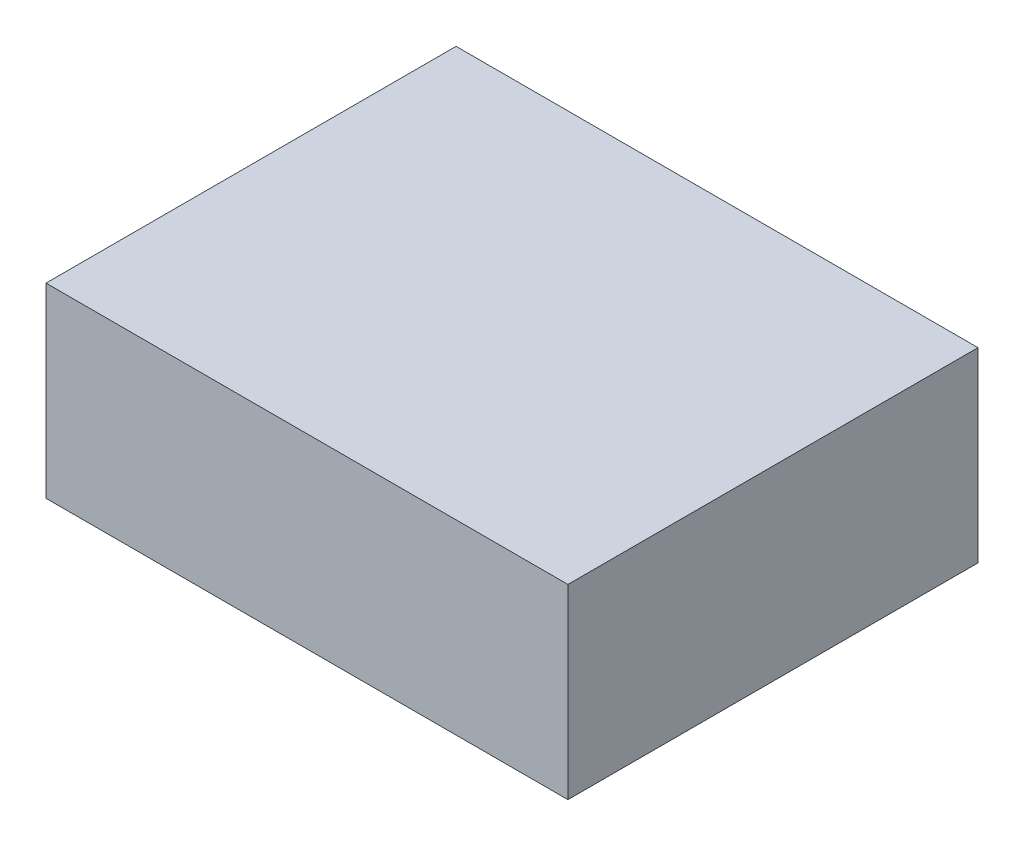
from build123d import *

# Parameters (mm, degrees)
SKETCH1_W           = 140
SKETCH1_H           = 110
BOSS_EXTRUDE1_DEPTH = 50


with BuildPart() as part:
    # Sketch1 → Boss-Extrude1 (new body)
    with BuildSketch(Plane(origin=(0, 0, 0), x_dir=(1, 0, 0), z_dir=(0, 1, 0))):
        Rectangle(SKETCH1_W, SKETCH1_H)
    extrude(amount=BOSS_EXTRUDE1_DEPTH)


solid = part.part
